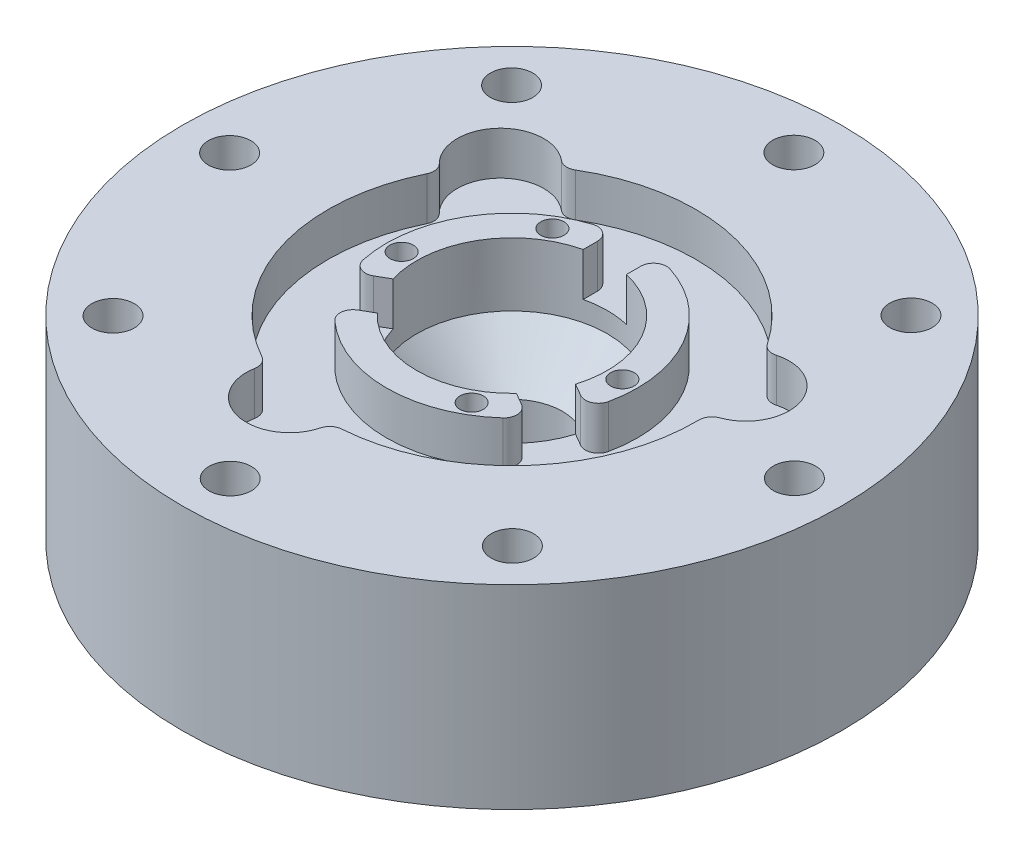
from build123d import *

# Parameters (mm, degrees)
SKETCH6_R                      = 42.5
SKETCH6_R_2                    = 29
CUT_EXTRUDE3_DEPTH             = 10
SKETCH7_W                      = 10
SKETCH7_H                      = 7.550043706
CUT_EXTRUDE4_DEPTH             = 10
CIRPATTERN2_COUNT              = 3
DELETEFACE1_START              = 15
DELETEFACE1_OUTLINE_R          = 76.2
DELETEFACE1_OUTLINE_R_2        = 55
DELETEFACE1_DEPTH              = 20
F_3_8_CLEARANCE_HOLE1_D        = 9.8044
SKETCH46_R                     = 10
CUT_EXTRUDE5_DEPTH             = 10
CIRPATTERN6_COUNT              = 3
FILLET2_R                      = 3
CIRPATTERN7_COUNT              = 6
F_1_4_0_2500_DOWEL_HOLE1_D     = 6.35
F_1_4_0_2500_DOWEL_HOLE1_DEPTH = 9.906
F_1_4_0_2500_DOWEL_HOLE1_TIP   = 1.907732465


# Read off the part's stored shape, not the designer's step: DeleteFace1
with BuildPart() as part:
    # Sketch3 → Revolve1 (revolve)
    with BuildSketch(Plane(origin=(0, 0, 0), x_dir=(0, 0, -1), z_dir=(1, 0, 0))):
        with BuildLine():
            Line((76.2, 15), (55, 15))
            Line((55, 15), (55, 35))
            Line((55, 35), (22.025, 35))
            Line((22.025, 35), (22.025, 20.36))
            Line((22.025, 20.36), (11.665, 10))
            Line((11.665, 10), (11.665, 0))
            Line((11.665, 0), (16.665, 0))
            ThreePointArc((16.665, 0), (37.471852779, 3.234070807), (53.85, -10))
            Line((53.85, -10), (76.2, -10))
            Line((76.2, -10), (76.2, 15))
        make_face()
    revolve(axis=Axis((0, 0, 0), (0, 1, 0)))

    # Sketch6 → Cut-Extrude3 (cut)
    with BuildSketch(Plane(origin=(0, 35, 0), x_dir=(1, 0, 0), z_dir=(0, 1, 0))):
        with Locations(Location((0, 0, 0), (0, 0, 270))):
            Circle(SKETCH6_R)
        with Locations(Location((0, 0, 0), (0, 0, 270))):
            Circle(SKETCH6_R_2, mode=Mode.SUBTRACT)
    extrude(amount=-CUT_EXTRUDE3_DEPTH, mode=Mode.SUBTRACT)

    # Sketch7 → Cut-Extrude4 (cut)
    with BuildSketch(Plane(origin=(0, 35, 0), x_dir=(1, 0, 0), z_dir=(0, 1, 0))):
        with Locations((0, 25.224978147)):
            Rectangle(SKETCH7_W, SKETCH7_H)
    cut_extrude4 = extrude(amount=-CUT_EXTRUDE4_DEPTH, mode=Mode.SUBTRACT)

    # CirPattern2: Cut-Extrude4 ×3 about axis
    cirpattern2_axis = Axis((0, 0, 0), (0, 1, 0))
    for i in range(1, CIRPATTERN2_COUNT):
        add(cut_extrude4.rotate(cirpattern2_axis, i * 360 / CIRPATTERN2_COUNT), mode=Mode.SUBTRACT)

    # DeleteFace1 outline → DeleteFace1 (add)
    with BuildSketch(Plane(origin=(0, 0, 0), x_dir=(1, 0, 0), z_dir=(0, 1, 0)).offset(DELETEFACE1_START)):
        Circle(DELETEFACE1_OUTLINE_R)
        Circle(DELETEFACE1_OUTLINE_R_2, mode=Mode.SUBTRACT)
    extrude(amount=DELETEFACE1_DEPTH)

    # 3/8 Clearance Hole1 (through all)
    with Locations(Plane(origin=(0, -10, 0), x_dir=(-1, 0, 0), z_dir=(0, -1, 0))):
        with Locations((46.153593538, 46.060907757), (65.203960939, -0.061814491), (46.060915247, -46.146148146), (-0.061807016, -65.196515566), (-46.146140681, -46.053469867), (-65.196508083, 0.069252405), (-46.053462365, 46.15358606), (0.069259897, 65.203953456)):
            Hole(F_3_8_CLEARANCE_HOLE1_D / 2)

    # Sketch46 → Cut-Extrude5 (cut)
    with BuildSketch(Plane(origin=(0, 35, 0), x_dir=(1, 0, 0), z_dir=(0, 1, 0))):
        with Locations((41.099239846, 12.958540547)):
            Circle(SKETCH46_R)
    cut_extrude5 = extrude(amount=-CUT_EXTRUDE5_DEPTH, mode=Mode.SUBTRACT)

    # CirPattern6: Cut-Extrude5 ×3 about axis
    cirpattern6_axis = Axis((0, 0, 0), (0, 1, 0))
    for i in range(1, CIRPATTERN6_COUNT):
        add(cut_extrude5.rotate(cirpattern6_axis, i * 360 / CIRPATTERN6_COUNT), mode=Mode.SUBTRACT)

    # Fillet2
    fillet2_edges = [part.edges().sort_by_distance(p)[0] for p in [
        (36.469652208, 30, -21.822338734),
        (42.390969445, 30, -3.042319763),
        (-37.133525818, 30, -20.672475912),
        (-23.830210924, 30, -35.190496549),
        (0.66387361, 30, 42.494814646),
        (-18.560758521, 30, 38.232816312),
        (5, 30, -28.565713714),
        (-5, 30, -28.565713714),
        (27.238633754, 30, 9.952729838),
        (22.238633754, 30, 18.612983876),
        (-22.238633754, 30, 18.612983876),
        (-27.238633754, 30, 9.952729838),
    ]]
    fillet(fillet2_edges, radius=FILLET2_R)

    # Sketch51 → 1/4-28 Tapped Hole1 (revolve, cut)
    with BuildSketch(Plane(origin=(25.5125, 35, 0), x_dir=(0, 0, 1), z_dir=(1, 0, 0))):
        Polygon((0, 0), (0, 17.045388061), (2.7051, 15.42), (2.7051, 0), align=None)
    f_1_4_28_tapped_hole1 = revolve(axis=Axis((25.5125, 41.35, 0), (0, -1, 0)), mode=Mode.SUBTRACT)

    # CirPattern7: 1/4-28 Tapped Hole1 ×6 about axis, 2 skipped
    cirpattern7_axis = Axis((0, 0, 0), (0, -1, 0))
    add([f_1_4_28_tapped_hole1.rotate(cirpattern7_axis, i * 360 / CIRPATTERN7_COUNT) for i in range(1, CIRPATTERN7_COUNT) if i not in (2, 5)], mode=Mode.SUBTRACT)

    # 1/4 (0.2500) Dowel Hole1
    with Locations(Plane(origin=(0, -10, 0), x_dir=(-1, 0, 0), z_dir=(0, -1, 0))):
        with Locations((-25.007850676, -60.207814752), (25.01513322, 60.21585851)):
            Hole(F_1_4_0_2500_DOWEL_HOLE1_D / 2, depth=F_1_4_0_2500_DOWEL_HOLE1_DEPTH)
            with Locations((0, 0, -(F_1_4_0_2500_DOWEL_HOLE1_DEPTH + F_1_4_0_2500_DOWEL_HOLE1_TIP / 2))):  # 118° drill point
                Cone(0, F_1_4_0_2500_DOWEL_HOLE1_D / 2, F_1_4_0_2500_DOWEL_HOLE1_TIP, mode=Mode.SUBTRACT)


solid = part.part
